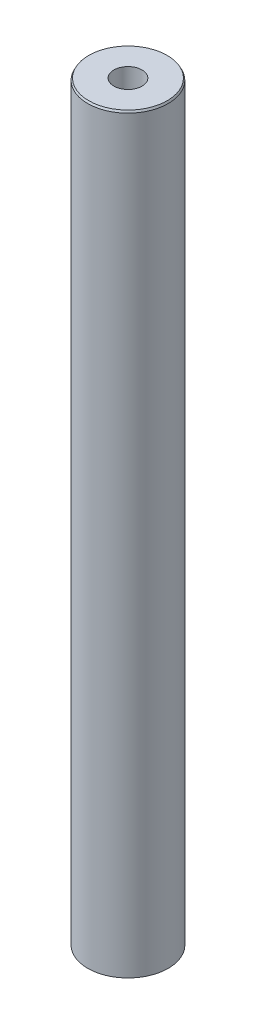
from build123d import *
from OCP.BRepFilletAPI import BRepFilletAPI_MakeChamfer

# Parameters (mm, degrees)
SKETCH1_R           = 5
BOSS_EXTRUDE1_DEPTH = 93.441526066
SKETCH2_R           = 1.748195344
CUT_EXTRUDE1_DEPTH  = 94.708691132
CHAMFER1_SIZE       = 0.245801694
CHAMFER1_SIZE2      = 0.122696255


with BuildPart() as part:
    # Sketch1 → Boss-Extrude1 (new body)
    with BuildSketch(Plane(origin=(0, 0, 0), x_dir=(1, 0, 0), z_dir=(0, 1, 0))):
        Circle(SKETCH1_R)
    extrude(amount=BOSS_EXTRUDE1_DEPTH)

    # Sketch2 → Cut-Extrude1 (cut, through all)
    with BuildSketch(Plane(origin=(0, 0, 0), x_dir=(1, 0, 0), z_dir=(0, 1, 0))):
        Circle(SKETCH2_R)
    extrude(amount=CUT_EXTRUDE1_DEPTH, mode=Mode.SUBTRACT)

    # Chamfer1: one chamfer whose edges measure the first distance from different faces: ONE call of the kernel's chamfer builder (chamfer() names one face for all edges)
    chamfer1_edges_1 = [part.edges().sort_by_distance(p)[0] for p in [
        (-5, 93.441526066, 0),
    ]]
    chamfer1_side_1 = [part.faces().sort_by_distance(p)[0] for p in [
        (-5, 46.720763033, 0),
    ]]
    chamfer1_edges_2 = [part.edges().sort_by_distance(p)[0] for p in [
        (-5, 0, 0),
    ]]
    chamfer1_side_2 = [part.faces().sort_by_distance(p)[0] for p in [
        (-4.858578644, 0, 0),
    ]]
    chamfer1 = BRepFilletAPI_MakeChamfer(part.part.solid().wrapped)
    for e in chamfer1_edges_1:
        chamfer1.Add(CHAMFER1_SIZE, CHAMFER1_SIZE2, e.wrapped, chamfer1_side_1[0].wrapped)  # the first distance lies on this face
    for e in chamfer1_edges_2:
        chamfer1.Add(CHAMFER1_SIZE, CHAMFER1_SIZE2, e.wrapped, chamfer1_side_2[0].wrapped)  # the first distance lies on this face
    add(Compound.cast(chamfer1.Shape()), mode=Mode.REPLACE)


solid = part.part
